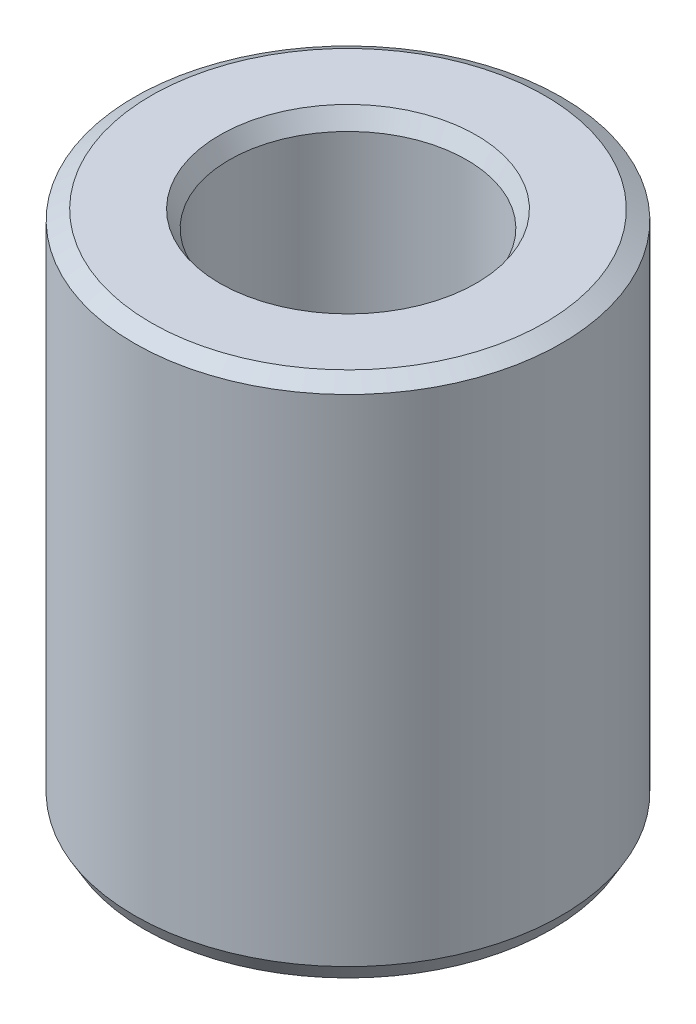
from build123d import *
from OCP.BRepFilletAPI import BRepFilletAPI_MakeChamfer

# Parameters (mm, degrees)
SKETCH1_R           = 35
BOSS_EXTRUDE1_DEPTH = 85.541448278
SKETCH2_R           = 19.468141753
CUT_EXTRUDE1_DEPTH  = 99.82985062
CHAMFER1_SIZE       = 1.573573616
CHAMFER1_SIZE2      = 2.725509452


with BuildPart() as part:
    # Sketch1 → Boss-Extrude1 (new body)
    with BuildSketch(Plane(origin=(0, 0, 0), x_dir=(1, 0, 0), z_dir=(0, 1, 0))):
        Circle(SKETCH1_R)
    extrude(amount=BOSS_EXTRUDE1_DEPTH)

    # Sketch2 → Cut-Extrude1 (cut, through all)
    with BuildSketch(Plane(origin=(0, 0, 0), x_dir=(1, 0, 0), z_dir=(0, 1, 0))):
        Circle(SKETCH2_R)
    extrude(amount=CUT_EXTRUDE1_DEPTH, mode=Mode.SUBTRACT)

    # Chamfer1: one chamfer whose edges measure the first distance from different faces: ONE call of the kernel's chamfer builder (chamfer() names one face for all edges)
    chamfer1_edges_1 = [part.edges().sort_by_distance(p)[0] for p in [
        (-19.468141753, 85.541448278, 0),
    ]]
    chamfer1_side_1 = [part.faces().sort_by_distance(p)[0] for p in [
        (-34.010050506, 85.541448278, 0),
    ]]
    chamfer1_edges_2 = [part.edges().sort_by_distance(p)[0] for p in [
        (-19.468141753, 0, 0),
    ]]
    chamfer1_side_2 = [part.faces().sort_by_distance(p)[0] for p in [
        (-19.468141753, 42.770724139, 0),
    ]]
    chamfer1_edges_3 = [part.edges().sort_by_distance(p)[0] for p in [
        (-35, 0, 0),
    ]]
    chamfer1_side_3 = [part.faces().sort_by_distance(p)[0] for p in [
        (-34.010050506, 0, 0),
    ]]
    chamfer1_edges_4 = [part.edges().sort_by_distance(p)[0] for p in [
        (-35, 85.541448278, 0),
    ]]
    chamfer1_side_4 = [part.faces().sort_by_distance(p)[0] for p in [
        (-35, 42.770724139, 0),
    ]]
    chamfer1 = BRepFilletAPI_MakeChamfer(part.part.solid().wrapped)
    for e in chamfer1_edges_1:
        chamfer1.Add(CHAMFER1_SIZE, CHAMFER1_SIZE2, e.wrapped, chamfer1_side_1[0].wrapped)  # the first distance lies on this face
    for e in chamfer1_edges_2:
        chamfer1.Add(CHAMFER1_SIZE, CHAMFER1_SIZE2, e.wrapped, chamfer1_side_2[0].wrapped)  # the first distance lies on this face
    for e in chamfer1_edges_3:
        chamfer1.Add(CHAMFER1_SIZE, CHAMFER1_SIZE2, e.wrapped, chamfer1_side_3[0].wrapped)  # the first distance lies on this face
    for e in chamfer1_edges_4:
        chamfer1.Add(CHAMFER1_SIZE, CHAMFER1_SIZE2, e.wrapped, chamfer1_side_4[0].wrapped)  # the first distance lies on this face
    add(Compound.cast(chamfer1.Shape()), mode=Mode.REPLACE)


solid = part.part
